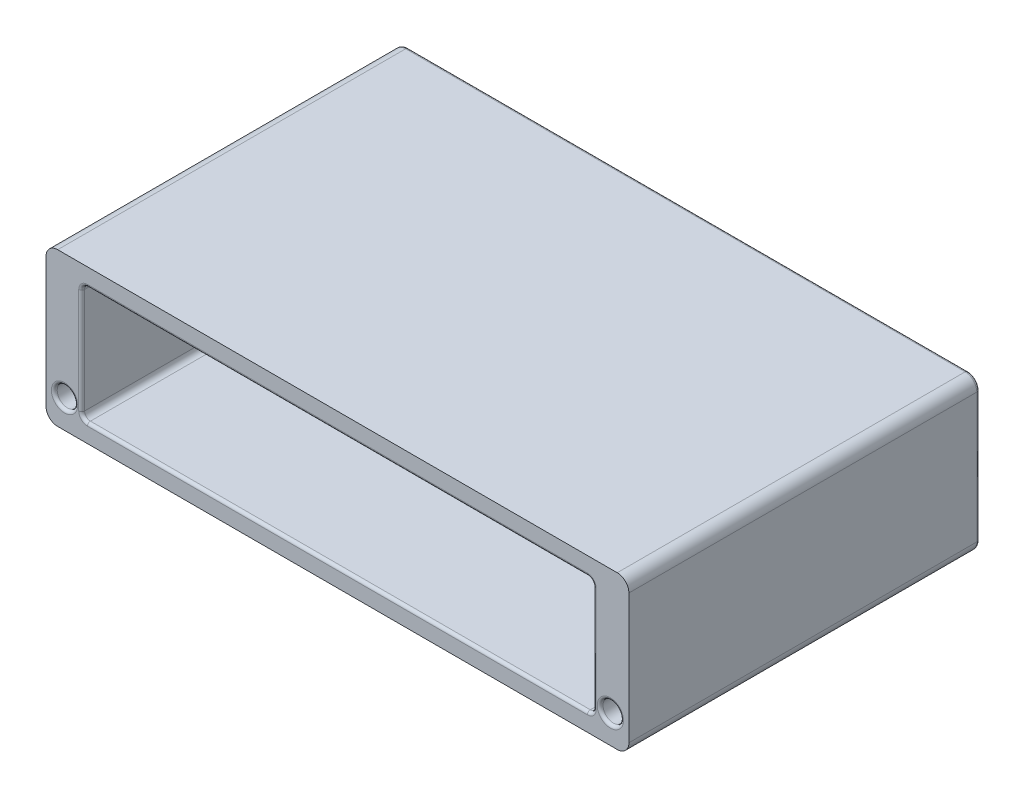
from build123d import *

# Parameters (mm, degrees)
SKETCH_2_W          = 398.782397078
SKETCH_2_H          = 104.750177952
SKETCH_2_R          = 7
SKETCH_2_W_2        = 350
SKETCH_2_H_2        = 80
EXTRUDE_2_DEPTH     = 240
SKETCH_7_W          = 350
SKETCH_7_H          = 12.375088976
CUT_EXTRUDE_2_DEPTH = 25
FILLET_2_R          = 4
FILLET_8_R          = 8
FILLET_3_R          = 2
FILLET_5_R          = 2
FILLET_7_R          = 2
FILLET_9_R          = 2


with BuildPart() as part:
    # 草图2 → 凸台-拉伸2 (new body)
    with BuildSketch(Plane.XY):
        Rectangle(SKETCH_2_W, SKETCH_2_H)
        with Locations((-186.717084291, -33.023005364)):
            Circle(SKETCH_2_R, mode=Mode.SUBTRACT)
        with Locations(Location((186.717084291, -33.023005364, 0), (0, 0, 180))):
            Circle(SKETCH_2_R, mode=Mode.SUBTRACT)
        Rectangle(SKETCH_2_W_2, SKETCH_2_H_2, mode=Mode.SUBTRACT)
    extrude(amount=EXTRUDE_2_DEPTH)

    # 草图7 → 切除-拉伸2 (cut)
    with BuildSketch(Plane(origin=(0, 0, 0), x_dir=(-1, 0, 0), z_dir=(0, 0, -1))):
        with Locations((0, -46.187544488)):
            Rectangle(SKETCH_7_W, SKETCH_7_H)
    extrude(amount=-CUT_EXTRUDE_2_DEPTH, mode=Mode.SUBTRACT)

    # 圆角2
    fillet_2_edges = [part.edges().sort_by_distance(p)[0] for p in [
        (-175, 40, 120),
        (-175, -40, 132.5),
        (175, -40, 132.5),
        (175, 40, 120),
    ]]
    fillet(fillet_2_edges, radius=FILLET_2_R)

    # 圆角8
    fillet_8_edges = [part.edges().sort_by_distance(p)[0] for p in [
        (-199.391198539, 52.375088976, 120),
        (199.391198539, 52.375088976, 120),
        (199.391198539, -52.375088976, 120),
        (-199.391198539, -52.375088976, 120),
    ]]
    fillet(fillet_8_edges, radius=FILLET_8_R)

    # 圆角3
    fillet_3_edges = [part.edges().sort_by_distance(p)[0] for p in [
        (175, -8.187544488, 0),
        (183.195599269, -52.375088976, 0),
        (-175, -8.187544488, 0),
        (0, 40, 0),
        (-173.828427125, 38.828427125, 0),
        (173.828427125, 38.828427125, 0),
        (-199.391198539, 0, 0),
        (-183.195599269, -52.375088976, 0),
        (0, 52.375088976, 0),
        (199.391198539, 0, 0),
        (197.048052788, 50.031943226, 0),
        (197.048052788, -50.031943226, 0),
        (-197.048052788, -50.031943226, 0),
        (-197.048052788, 50.031943226, 0),
    ]]
    fillet(fillet_3_edges, radius=FILLET_3_R)

    # 圆角5
    fillet_5_edges = [part.edges().sort_by_distance(p)[0] for p in [
        (0, -40, 240),
        (175, 0, 240),
        (-175, 0, 240),
        (0, 40, 240),
        (173.828427125, -38.828427125, 240),
        (-173.828427125, -38.828427125, 240),
        (-173.828427125, 38.828427125, 240),
        (173.828427125, 38.828427125, 240),
    ]]
    fillet(fillet_5_edges, radius=FILLET_5_R)

    # 圆角7
    fillet_7_edges = [part.edges().sort_by_distance(p)[0] for p in [
        (-193.717084291, -33.023005364, 0),
        (-193.717084291, -33.023005364, 240),
        (193.717084291, -33.023005364, 0),
        (193.717084291, -33.023005364, 240),
    ]]
    fillet(fillet_7_edges, radius=FILLET_7_R)

    # 圆角9
    # the kernel refuses this fillet: 2 mm, written as the material it takes off along each edge
    with BuildSketch(Plane(origin=(177, -50.375088976, 2), x_dir=(-1, 0, 0), z_dir=(0, -1, 0))) as fillet_9_piece_1_section:
        Polygon((0, 0), (FILLET_9_R * 1.02, 0), (FILLET_9_R * 1.02, FILLET_9_R * 1.02), (0, FILLET_9_R * 1.02), align=None)
    fillet_9_piece_1 = extrude(amount=FILLET_9_R * 1.02, mode=Mode.PRIVATE)
    fillet_9_piece_1 = fillet_9_piece_1 - Plane(origin=(177, -50.375088976, 2), x_dir=(0.7071067811865475, 0, 0.7071067811865475), z_dir=(0, -1, 0)) * Sphere(FILLET_9_R, mode=Mode.PRIVATE)
    add(fillet_9_piece_1, mode=Mode.SUBTRACT)
    with BuildSketch(Plane(origin=(-177, -50.375088976, 2), x_dir=(1, 0, 0), z_dir=(0, -1, 0))) as fillet_9_piece_2_section:
        Polygon((0, 0), (FILLET_9_R * 1.02, 0), (FILLET_9_R * 1.02, -FILLET_9_R * 1.02), (0, -FILLET_9_R * 1.02), align=None)
    fillet_9_piece_2 = extrude(amount=FILLET_9_R * 1.02, mode=Mode.PRIVATE)
    fillet_9_piece_2 = fillet_9_piece_2 - Plane(origin=(-177, -50.375088976, 2), x_dir=(-0.7071067811865475, 0, 0.7071067811865475), z_dir=(0, -1, 0)) * Sphere(FILLET_9_R, mode=Mode.PRIVATE)
    add(fillet_9_piece_2, mode=Mode.SUBTRACT)
    with BuildSketch(Plane(origin=(175, -52.375088976, 2), x_dir=(1, 0, 0), z_dir=(0, 0, 1))) as fillet_9_piece_3:
        with BuildLine():
            CenterArc((FILLET_9_R, FILLET_9_R), FILLET_9_R, 180, 90)
            Line((0, FILLET_9_R), (0, 0))
            Line((0, 0), (FILLET_9_R, 0))
        make_face()
    extrude(amount=23, mode=Mode.SUBTRACT)
    with BuildSketch(Plane(origin=(-175, -52.375088976, 25), x_dir=(0, 0, 1), z_dir=(1, 0, 0))) as fillet_9_piece_4:
        with BuildLine():
            CenterArc((FILLET_9_R, -FILLET_9_R), FILLET_9_R, 90, 90)
            Line((0, -FILLET_9_R), (0, 0))
            Line((0, 0), (FILLET_9_R, 0))
        make_face()
    extrude(amount=350, mode=Mode.SUBTRACT)
    with BuildSketch(Plane(origin=(-175, -52.375088976, 2), x_dir=(-1, 0, 0), z_dir=(0, 0, 1))) as fillet_9_piece_5:
        with BuildLine():
            CenterArc((FILLET_9_R, -FILLET_9_R), FILLET_9_R, 90, 90)
            Line((0, -FILLET_9_R), (0, 0))
            Line((0, 0), (FILLET_9_R, 0))
        make_face()
    extrude(amount=23, mode=Mode.SUBTRACT)
    with BuildSketch(Plane(origin=(171, -40, 25), x_dir=(0, 0, 1), z_dir=(-1, 0, 0))) as fillet_9_piece_6:
        with BuildLine():
            CenterArc((FILLET_9_R, -FILLET_9_R), FILLET_9_R, 90, 90)
            Line((0, -FILLET_9_R), (0, 0))
            Line((0, 0), (FILLET_9_R, 0))
        make_face()
    extrude(amount=342, mode=Mode.SUBTRACT)
    with BuildSketch(Plane(origin=(171, -36, 25), x_dir=(0, -1, 0), z_dir=(-1, 0, 0))) as fillet_9_piece_7_section:
        with BuildLine():
            CenterArc((4 + FILLET_9_R, FILLET_9_R), FILLET_9_R, 180, 90)
            Line((4 + FILLET_9_R, 0), (4, 0))
            Line((4, 0), (4, FILLET_9_R))
        make_face()
    fillet_9_piece_7 = revolve(axis=Axis((171, -36, 25), (0, 0, 1)), revolution_arc=161.648494619, mode=Mode.PRIVATE)
    fillet_9_piece_7 = split(fillet_9_piece_7, bisect_by=Plane(origin=(175, -36, 25), z_dir=(-1, 0, 0)), keep=Keep.TOP, mode=Mode.PRIVATE)
    add(fillet_9_piece_7, mode=Mode.SUBTRACT)
    with BuildSketch(Plane(origin=(-171, -36, 25), x_dir=(0, -1, 0), z_dir=(1, 0, 0))) as fillet_9_piece_8_section:
        with BuildLine():
            CenterArc((4 + FILLET_9_R, -FILLET_9_R), FILLET_9_R, 90, 90)
            Line((4 + FILLET_9_R, 0), (4, 0))
            Line((4, 0), (4, -FILLET_9_R))
        make_face()
    fillet_9_piece_8 = revolve(axis=Axis((-171, -36, 25), (0, 0, -1)), revolution_arc=161.648494619, mode=Mode.PRIVATE)
    fillet_9_piece_8 = split(fillet_9_piece_8, bisect_by=Plane(origin=(-175, -36, 25), z_dir=(1, 0, 0)), keep=Keep.TOP, mode=Mode.PRIVATE)
    add(fillet_9_piece_8, mode=Mode.SUBTRACT)
    with BuildSketch(Plane(origin=(175, -52.375088976, 2), x_dir=(1, 0, 0), z_dir=(0, 0, 1))) as fillet_9_piece_9a_section:
        with BuildLine():
            CenterArc((FILLET_9_R, FILLET_9_R), FILLET_9_R, 180, 90)
            Line((0, FILLET_9_R), (0, 0))
            Line((0, 0), (FILLET_9_R, 0))
        make_face()
    fillet_9_piece_9a = extrude(amount=28, mode=Mode.PRIVATE)
    fillet_9_piece_9a = split(fillet_9_piece_9a, bisect_by=Plane(origin=(175, -52.375088976, 25), z_dir=(0, 0, 1)), keep=Keep.TOP, mode=Mode.PRIVATE)
    with BuildSketch(Plane(origin=(-175, -52.375088976, 25), x_dir=(0, 0, 1), z_dir=(1, 0, 0))) as fillet_9_piece_9b_section:
        with BuildLine():
            CenterArc((FILLET_9_R, -FILLET_9_R), FILLET_9_R, 90, 90)
            Line((0, -FILLET_9_R), (0, 0))
            Line((0, 0), (FILLET_9_R, 0))
        make_face()
    fillet_9_piece_9b = extrude(amount=355, mode=Mode.PRIVATE)
    fillet_9_piece_9b = split(fillet_9_piece_9b, bisect_by=Plane(origin=(175, -52.375088976, 25), z_dir=(1, 0, 0)), keep=Keep.TOP, mode=Mode.PRIVATE)
    fillet_9_piece_9 = fillet_9_piece_9a & fillet_9_piece_9b
    add(fillet_9_piece_9, mode=Mode.SUBTRACT)
    with BuildSketch(Plane(origin=(-180, -52.375088976, 25), x_dir=(0, 0, 1), z_dir=(1, 0, 0))) as fillet_9_piece_10a_section:
        with BuildLine():
            CenterArc((FILLET_9_R, -FILLET_9_R), FILLET_9_R, 90, 90)
            Line((0, -FILLET_9_R), (0, 0))
            Line((0, 0), (FILLET_9_R, 0))
        make_face()
    fillet_9_piece_10a = extrude(amount=355, mode=Mode.PRIVATE)
    fillet_9_piece_10a = split(fillet_9_piece_10a, bisect_by=Plane(origin=(-175, -52.375088976, 25), z_dir=(-1, 0, 0)), keep=Keep.TOP, mode=Mode.PRIVATE)
    with BuildSketch(Plane(origin=(-175, -52.375088976, 2), x_dir=(-1, 0, 0), z_dir=(0, 0, 1))) as fillet_9_piece_10b_section:
        with BuildLine():
            CenterArc((FILLET_9_R, -FILLET_9_R), FILLET_9_R, 90, 90)
            Line((0, -FILLET_9_R), (0, 0))
            Line((0, 0), (FILLET_9_R, 0))
        make_face()
    fillet_9_piece_10b = extrude(amount=28, mode=Mode.PRIVATE)
    fillet_9_piece_10b = split(fillet_9_piece_10b, bisect_by=Plane(origin=(-175, -52.375088976, 25), z_dir=(0, 0, 1)), keep=Keep.TOP, mode=Mode.PRIVATE)
    fillet_9_piece_10 = fillet_9_piece_10a & fillet_9_piece_10b
    add(fillet_9_piece_10, mode=Mode.SUBTRACT)


solid = part.part
